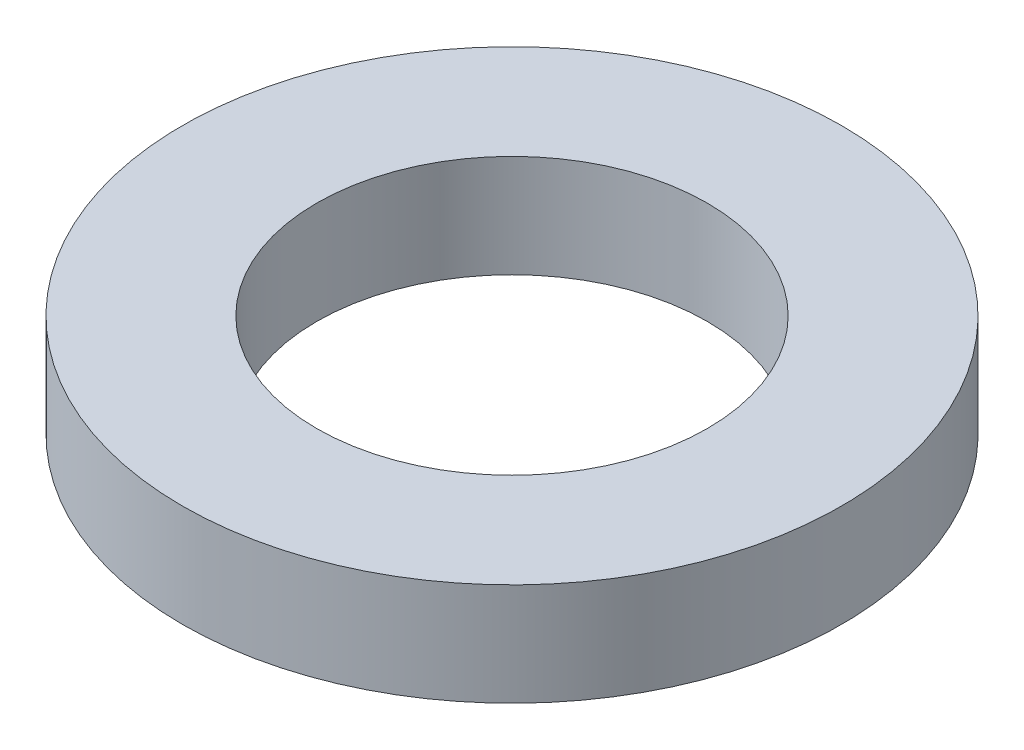
from build123d import *

# Parameters (mm, degrees)
SKETCH1_R           = 67.5
BOSS_EXTRUDE1_DEPTH = 21
SKETCH2_R           = 40
CUT_EXTRUDE1_DEPTH  = 98.742007346


with BuildPart() as part:
    # Sketch1 → Boss-Extrude1 (new body)
    with BuildSketch(Plane(origin=(0, 0, 0), x_dir=(1, 0, 0), z_dir=(0, 1, 0))):
        Circle(SKETCH1_R)
    extrude(amount=BOSS_EXTRUDE1_DEPTH)

    # Sketch2 → Cut-Extrude1 (cut, through all)
    with BuildSketch(Plane(origin=(0, 0, 0), x_dir=(1, 0, 0), z_dir=(0, 1, 0))):
        Circle(SKETCH2_R)
    extrude(amount=CUT_EXTRUDE1_DEPTH, mode=Mode.SUBTRACT)


solid = part.part
